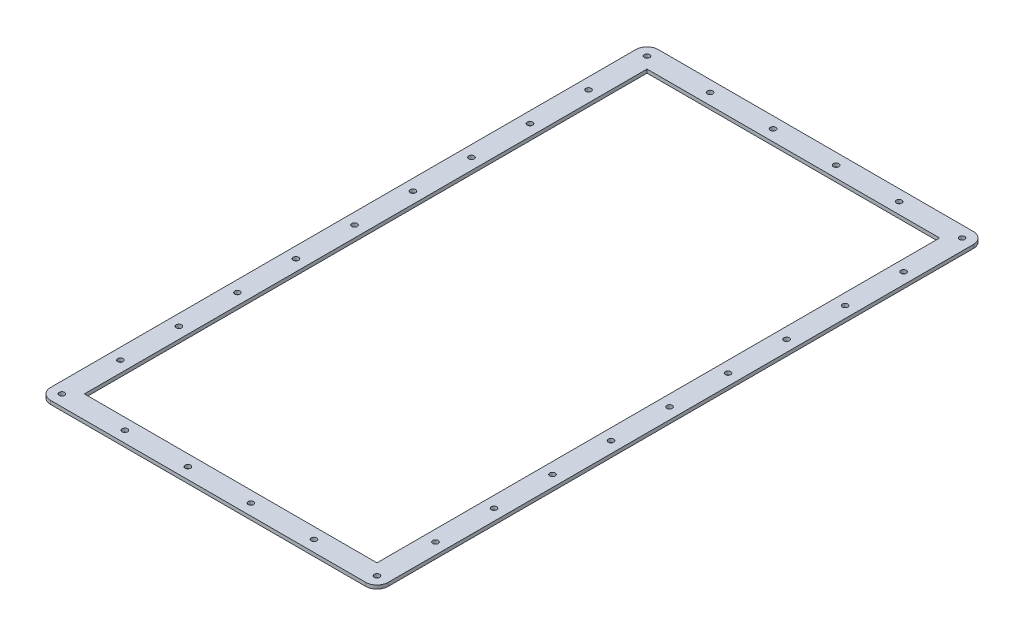
from build123d import *

# Parameters (mm, degrees)
SKETCH1_W           = 300
SKETCH1_H           = 540
SKETCH1_R           = 2.408587511
SKETCH1_W_2         = 260
SKETCH1_H_2         = 500
BOSS_EXTRUDE1_DEPTH = 3.175
FILLET1_R           = 10


with BuildPart() as part:
    # Sketch1 → Boss-Extrude1 (new body)
    with BuildSketch(Plane(origin=(0, 0, 0), x_dir=(1, 0, 0), z_dir=(0, 1, 0))):
        Rectangle(SKETCH1_W, SKETCH1_H)
        with Locations((-140, -260)):
            Circle(SKETCH1_R, mode=Mode.SUBTRACT)
        with Locations((-140, -208)):
            Circle(SKETCH1_R, mode=Mode.SUBTRACT)
        with Locations((-84, -260)):
            Circle(SKETCH1_R, mode=Mode.SUBTRACT)
        with Locations((-140, -156)):
            Circle(SKETCH1_R, mode=Mode.SUBTRACT)
        with Locations((-28, -260)):
            Circle(SKETCH1_R, mode=Mode.SUBTRACT)
        with Locations((-140, -104)):
            Circle(SKETCH1_R, mode=Mode.SUBTRACT)
        with Locations((-140, -52)):
            Circle(SKETCH1_R, mode=Mode.SUBTRACT)
        with Locations((-140, 0)):
            Circle(SKETCH1_R, mode=Mode.SUBTRACT)
        with Locations((28, -260)):
            Circle(SKETCH1_R, mode=Mode.SUBTRACT)
        with Locations((84, -260)):
            Circle(SKETCH1_R, mode=Mode.SUBTRACT)
        with Locations((140, -260)):
            Circle(SKETCH1_R, mode=Mode.SUBTRACT)
        with Locations((140, -208)):
            Circle(SKETCH1_R, mode=Mode.SUBTRACT)
        with Locations((140, -156)):
            Circle(SKETCH1_R, mode=Mode.SUBTRACT)
        with Locations((140, -104)):
            Circle(SKETCH1_R, mode=Mode.SUBTRACT)
        with Locations((140, -52)):
            Circle(SKETCH1_R, mode=Mode.SUBTRACT)
        with Locations((140, 0)):
            Circle(SKETCH1_R, mode=Mode.SUBTRACT)
        with Locations((-140, 52)):
            Circle(SKETCH1_R, mode=Mode.SUBTRACT)
        with Locations((-140, 104)):
            Circle(SKETCH1_R, mode=Mode.SUBTRACT)
        with Locations((-140, 156)):
            Circle(SKETCH1_R, mode=Mode.SUBTRACT)
        with Locations((-140, 208)):
            Circle(SKETCH1_R, mode=Mode.SUBTRACT)
        with Locations((-140, 260)):
            Circle(SKETCH1_R, mode=Mode.SUBTRACT)
        with Locations((-84, 260)):
            Circle(SKETCH1_R, mode=Mode.SUBTRACT)
        with Locations((-28, 260)):
            Circle(SKETCH1_R, mode=Mode.SUBTRACT)
        Rectangle(SKETCH1_W_2, SKETCH1_H_2, mode=Mode.SUBTRACT)
        with Locations((140, 52)):
            Circle(SKETCH1_R, mode=Mode.SUBTRACT)
        with Locations((140, 104)):
            Circle(SKETCH1_R, mode=Mode.SUBTRACT)
        with Locations((28, 260)):
            Circle(SKETCH1_R, mode=Mode.SUBTRACT)
        with Locations((140, 156)):
            Circle(SKETCH1_R, mode=Mode.SUBTRACT)
        with Locations((84, 260)):
            Circle(SKETCH1_R, mode=Mode.SUBTRACT)
        with Locations((140, 208)):
            Circle(SKETCH1_R, mode=Mode.SUBTRACT)
        with Locations((140, 260)):
            Circle(SKETCH1_R, mode=Mode.SUBTRACT)
    extrude(amount=BOSS_EXTRUDE1_DEPTH)

    # Fillet1
    fillet1_edges = [part.edges().sort_by_distance(p)[0] for p in [
        (150, 1.5875, 270),
        (-150, 1.5875, 270),
        (150, 1.5875, -270),
        (-150, 1.5875, -270),
    ]]
    fillet(fillet1_edges, radius=FILLET1_R)


solid = part.part
